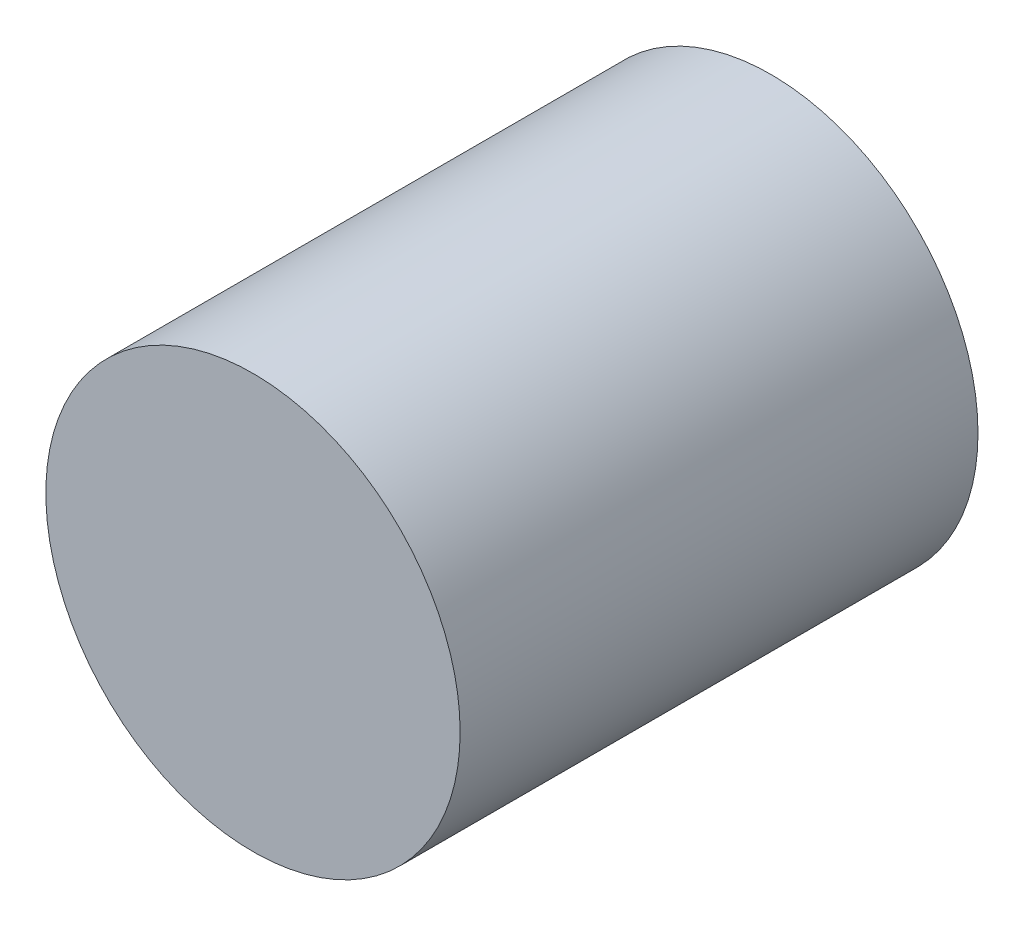
from build123d import *

# Parameters (mm, degrees)
SKETCH1_R           = 12
BOSS_EXTRUDE1_DEPTH = 30


with BuildPart() as part:
    # Sketch1 → Boss-Extrude1 (new body)
    with BuildSketch(Plane.XY):
        Circle(SKETCH1_R)
    extrude(amount=BOSS_EXTRUDE1_DEPTH)


solid = part.part
